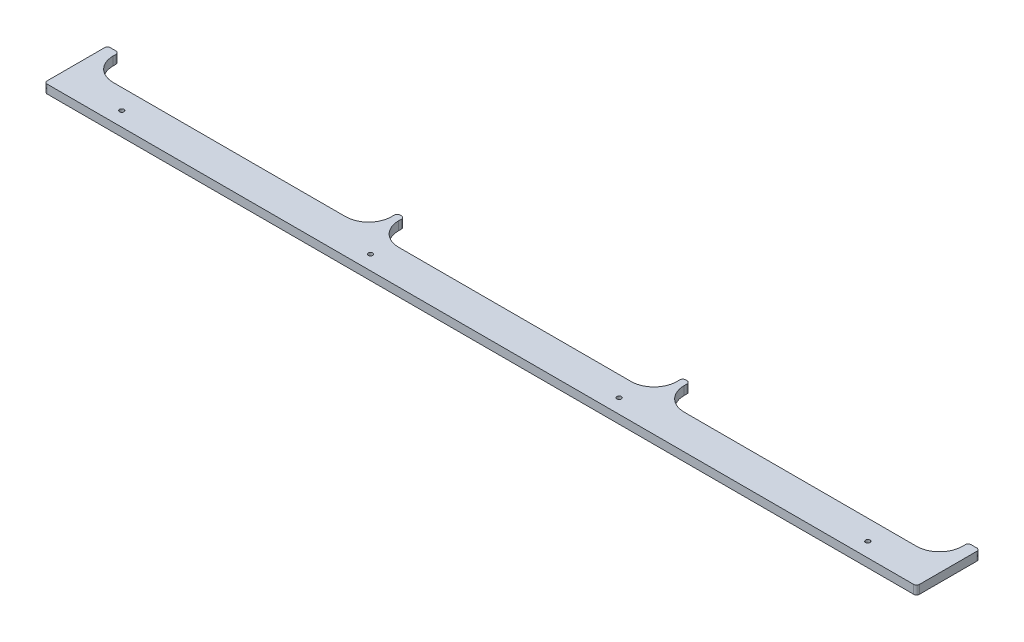
from build123d import *

# Parameters (mm, degrees)
SKETCH1_R           = 2.45745
BOSS_EXTRUDE1_DEPTH = 9.525
FILLET1_R           = 3.175


with BuildPart() as part:
    # Sketch1 → Boss-Extrude1 (new body)
    with BuildSketch(Plane(origin=(0, 0, 0), x_dir=(1, 0, 0), z_dir=(0, 1, 0))):
        with BuildLine():
            Line((0, 0), (965.2, 0))
            Line((965.2, 0), (965.2, 69.85))
            Line((965.2, 69.85), (952.5, 69.85))
            Line((952.5, 69.85), (952.5, 63.5))
            ThreePointArc((952.5, 63.5), (945.060512242, 45.539487758), (927.1, 38.1))
            Line((927.1, 38.1), (669.925, 38.1))
            ThreePointArc((669.925, 38.1), (651.964487758, 45.539487758), (644.525, 63.5))
            Line((644.525, 63.5), (644.525, 69.85))
            Line((644.525, 69.85), (636.5875, 69.85))
            Line((636.5875, 69.85), (636.5875, 63.5))
            ThreePointArc((636.5875, 63.5), (629.148012242, 45.539487758), (611.1875, 38.1))
            Line((611.1875, 38.1), (354.0125, 38.1))
            ThreePointArc((354.0125, 38.1), (336.051987758, 45.539487758), (328.6125, 63.5))
            Line((328.6125, 63.5), (328.6125, 69.85))
            Line((328.6125, 69.85), (320.675, 69.85))
            Line((320.675, 69.85), (320.675, 63.5))
            ThreePointArc((320.675, 63.5), (313.235512242, 45.539487758), (295.275, 38.1))
            Line((295.275, 38.1), (38.1, 38.1))
            ThreePointArc((38.1, 38.1), (20.139487758, 45.539487758), (12.7, 63.5))
            Line((12.7, 63.5), (12.7, 69.85))
            Line((12.7, 69.85), (0, 69.85))
            Line((0, 69.85), (0, 0))
        make_face()
        with Locations((69.85, 15.875)):
            Circle(SKETCH1_R, mode=Mode.SUBTRACT)
        with Locations((345.01582, 15.875)):
            Circle(SKETCH1_R, mode=Mode.SUBTRACT)
        with Locations((895.35, 15.875)):
            Circle(SKETCH1_R, mode=Mode.SUBTRACT)
        with Locations((620.18418, 15.875)):
            Circle(SKETCH1_R, mode=Mode.SUBTRACT)
    extrude(amount=BOSS_EXTRUDE1_DEPTH)

    # Fillet1
    fillet1_edges = [part.edges().sort_by_distance(p)[0] for p in [
        (0, 4.7625, 0),
        (965.2, 4.7625, 0),
        (965.2, 4.7625, -69.85),
        (952.5, 4.7625, -69.85),
        (644.525, 4.7625, -69.85),
        (636.5875, 4.7625, -69.85),
        (328.6125, 4.7625, -69.85),
        (12.7, 4.7625, -69.85),
        (0, 4.7625, -69.85),
        (320.675, 4.7625, -69.85),
    ]]
    fillet(fillet1_edges, radius=FILLET1_R)


solid = part.part
